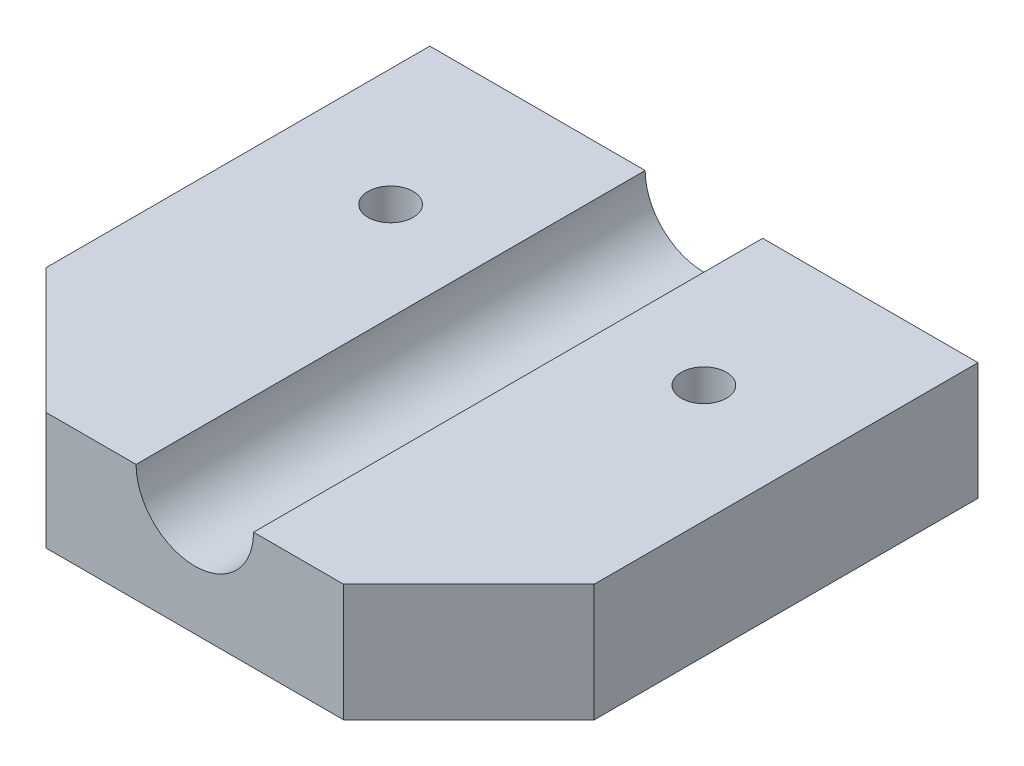
from build123d import *

# Parameters (mm, degrees)
SKETCH1_W                                     = 44.45
SKETCH1_H                                     = 41.275
BOSS_EXTRUDE1_DEPTH                           = 9.525
SKETCH4_R                                     = 4.7625
CUT_EXTRUDE1_DEPTH                            = 48.836198375
MOTORHOLES_D                                  = 2.2606
MOTORHOLES_DEPTH                              = 7.62
MOTORHOLES_TIP                                = 0.679152758
CBORE_FOR_6_SOCKET_HEAD_CAP_SCREW1_AT_2_COUNT = 2
CBORE_FOR_6_SOCKET_HEAD_CAP_SCREW1_AT_2_PITCH = 25.4
CHAMFER1_SIZE                                 = 10.16


with BuildPart() as part:
    # Sketch1 → Boss-Extrude1 (new body)
    with BuildSketch(Plane(origin=(0, 0, 0), x_dir=(1, 0, 0), z_dir=(0, 1, 0))):
        Rectangle(SKETCH1_W, SKETCH1_H)
    extrude(amount=BOSS_EXTRUDE1_DEPTH)

    # Sketch4 → Cut-Extrude1 (cut, through all)
    with BuildSketch(Plane.XY.offset(20.6375)):
        with Locations((0, 9.525)):
            Circle(SKETCH4_R)
    extrude(amount=-CUT_EXTRUDE1_DEPTH, mode=Mode.SUBTRACT)

    # MotorHoles
    with Locations(Plane(origin=(0, 0, 0), x_dir=(-1, 0, 0), z_dir=(0, -1, 0))):
        with Locations((-5.715, -17.4625), (5.715, -17.4625)):
            Hole(MOTORHOLES_D / 2, depth=MOTORHOLES_DEPTH)
            with Locations((0, 0, -(MOTORHOLES_DEPTH + MOTORHOLES_TIP / 2))):  # 118° drill point
                Cone(0, MOTORHOLES_D / 2, MOTORHOLES_TIP, mode=Mode.SUBTRACT)

    # Sketch5 → CBORE for #6 Socket Head Cap Screw1 (revolve, cut)
    with BuildSketch(Plane(origin=(12.7, 0, -7.9375), x_dir=(0, 0, -1), z_dir=(1, 0, 0))):
        Polygon((0, 0), (0, 9.525), (1.8288, 9.525), (1.8288, 3.5052), (3.57251, 3.5052), (3.57251, 0.635), (4.20751, 0), align=None)
    cbore_for_6_socket_head_cap_screw1 = revolve(axis=Axis((12.7, -6.35, -7.9375), (0, 1, 0)), mode=Mode.SUBTRACT)

    # CBORE for #6 Socket Head Cap Screw1 at 2: CBORE for #6 Socket Head Cap Screw1 ×2
    with Locations(*[(-i * CBORE_FOR_6_SOCKET_HEAD_CAP_SCREW1_AT_2_PITCH, 0, 0) for i in range(1, CBORE_FOR_6_SOCKET_HEAD_CAP_SCREW1_AT_2_COUNT)]):
        add(cbore_for_6_socket_head_cap_screw1, mode=Mode.SUBTRACT)

    # Chamfer1
    chamfer1_edges = [part.edges().sort_by_distance(p)[0] for p in [
        (22.225, 4.7625, 20.6375),
        (-22.225, 4.7625, 20.6375),
    ]]
    chamfer(chamfer1_edges, length=CHAMFER1_SIZE)


solid = part.part
